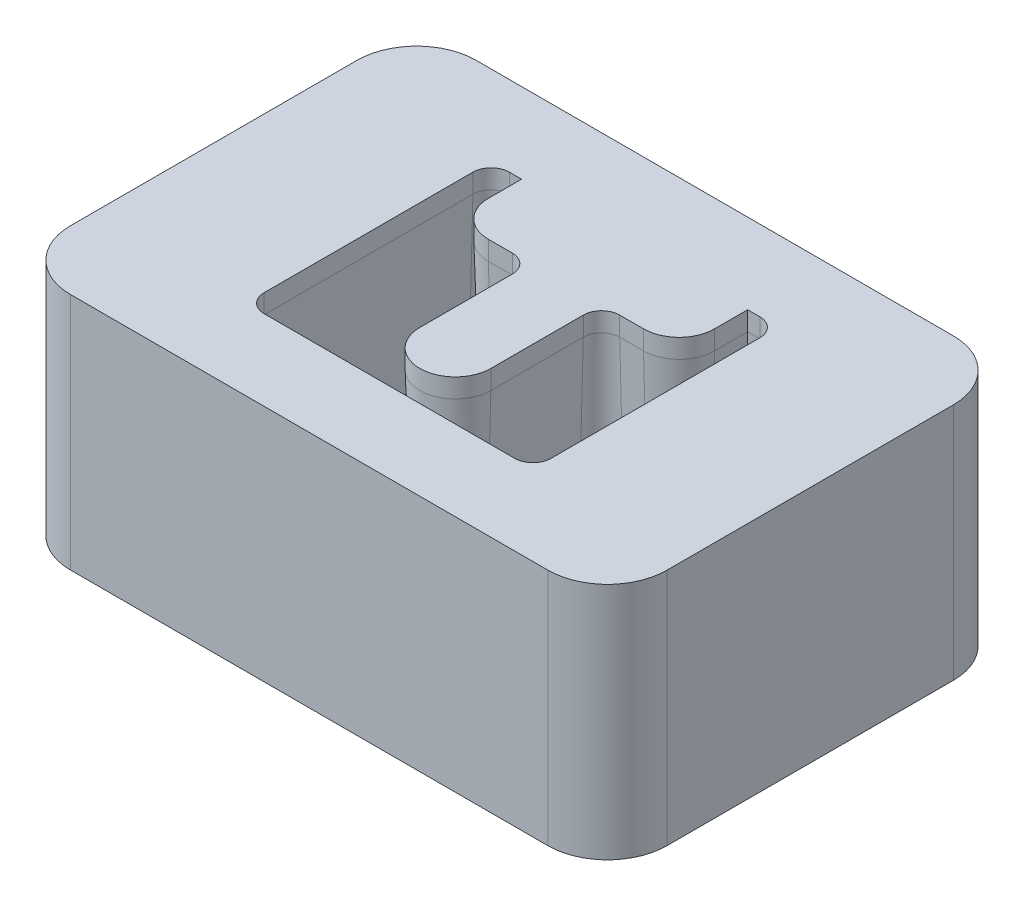
from build123d import *

# Parameters (mm, degrees)
SKETCH1_W                   = 100
SKETCH1_H                   = 68
BOSS_EXTRUDE1_DEPTH         = 40
FILLET1_R                   = 10
CUT_EXTRUDE1_REACH          = 74.498
M6_TAPPED_HOLE1_D           = 5
M6_TAPPED_HOLE1_DEPTH       = 17
M6_TAPPED_HOLE1_CSINK_D     = 6.05
M6_TAPPED_HOLE1_CSINK_ANGLE = 90
M6_TAPPED_HOLE1_TIP         = 1.502151548


with BuildPart() as part:
    # Sketch1 → Boss-Extrude1 (new body)
    with BuildSketch(Plane(origin=(0, 0, 0), x_dir=(1, 0, 0), z_dir=(0, 1, 0))):
        Rectangle(SKETCH1_W, SKETCH1_H)
    extrude(amount=-BOSS_EXTRUDE1_DEPTH)

    # Fillet1
    fillet1_edges = [part.edges().sort_by_distance(p)[0] for p in [
        (-50, -20, -34),
        (50, -20, -34),
        (50, -20, 34),
        (-50, -20, 34),
    ]]
    fillet(fillet1_edges, radius=FILLET1_R)

    # Sketch2 → Cut-Extrude1 (cut, up to next)
    with BuildSketch(Plane(origin=(0, 0, 0), x_dir=(1, 0, 0), z_dir=(0, 1, 0)), mode=Mode.PRIVATE) as cut_extrude1_sk1:
        with BuildLine():
            Line((-21, -20.55), (21, -20.55))
            ThreePointArc((21, -20.55), (23.156675683, -19.656675683), (24.05, -17.5))
            Line((24.05, -17.5), (24.05, 17.5))
            ThreePointArc((24.05, 17.5), (23.156675683, 19.656675683), (21, 20.55))
            Line((21, 20.55), (18.95, 20.55))
            Line((18.95, 20.55), (18.95, 15))
            ThreePointArc((18.95, 15), (17.207285348, 10.792714652), (13, 9.05))
            Line((13, 9.05), (9, 9.05))
            ThreePointArc((9, 9.05), (6.843324317, 8.156675683), (5.95, 6))
            Line((5.95, 6), (5.95, -9.5))
            ThreePointArc((5.95, -9.5), (0, -15.45), (-5.95, -9.5))
            Line((-5.95, -9.5), (-5.95, 6))
            ThreePointArc((-5.95, 6), (-6.843324317, 8.156675683), (-9, 9.05))
            Line((-9, 9.05), (-13, 9.05))
            ThreePointArc((-13, 9.05), (-17.207285348, 10.792714652), (-18.95, 15))
            Line((-18.95, 15), (-18.95, 20.55))
            Line((-18.95, 20.55), (-21, 20.55))
            ThreePointArc((-21, 20.55), (-23.156675683, 19.656675683), (-24.05, 17.5))
            Line((-24.05, 17.5), (-24.05, -17.5))
            ThreePointArc((-24.05, -17.5), (-23.156675683, -19.656675683), (-21, -20.55))
        make_face()
    cut_extrude1_tool1 = extrude(cut_extrude1_sk1.sketch, amount=-CUT_EXTRUDE1_REACH, mode=Mode.PRIVATE) & part.part
    add(cut_extrude1_tool1.solids().sort_by_distance((0, 0, 19.917322))[0], mode=Mode.SUBTRACT)

    # Cut-Sweep1: sweep along a path in Sketch5
    with BuildLine(Plane(origin=(0, 0, 0), x_dir=(1, 0, 0), z_dir=(0, 1, 0))) as cut_sweep1_path:
        Line((-21, -20.55), (21, -20.55))
        ThreePointArc((21, -20.55), (23.156675683, -19.656675683), (24.05, -17.5))
        Line((24.05, -17.5), (24.05, 17.5))
        ThreePointArc((24.05, 17.5), (23.156675683, 19.656675683), (21, 20.55))
        Line((21, 20.55), (18.95, 20.55))
        Line((18.95, 20.55), (18.95, 15))
        ThreePointArc((18.95, 15), (17.207285348, 10.792714652), (13, 9.05))
        Line((13, 9.05), (9, 9.05))
        ThreePointArc((9, 9.05), (6.843324317, 8.156675683), (5.95, 6))
        Line((5.95, 6), (5.95, -9.5))
        ThreePointArc((5.95, -9.5), (0, -15.45), (-5.95, -9.5))
        Line((-5.95, -9.5), (-5.95, 6))
        ThreePointArc((-5.95, 6), (-6.843324317, 8.156675683), (-9, 9.05))
        Line((-9, 9.05), (-13, 9.05))
        ThreePointArc((-13, 9.05), (-17.207285348, 10.792714652), (-18.95, 15))
        Line((-18.95, 15), (-18.95, 20.55))
        Line((-18.95, 20.55), (-21, 20.55))
        ThreePointArc((-21, 20.55), (-23.156675683, 19.656675683), (-24.05, 17.5))
        Line((-24.05, 17.5), (-24.05, -17.5))
        ThreePointArc((-24.05, -17.5), (-23.156675683, -19.656675683), (-21, -20.55))
    # Sketch3 → Cut-Sweep1 (sweep, cut)
    with BuildSketch(Plane.XY):
        Polygon((24.05, -3.2), (25.013641914, -40), (23.05, -40), (23.05, -3.2), align=None)
    sweep(path=cut_sweep1_path.line, transition=Transition.RIGHT, mode=Mode.SUBTRACT)

    # M6 Tapped Hole1
    with Locations(Plane(origin=(0, -40, 0), x_dir=(-1, 0, 0), z_dir=(0, -1, 0))):
        with Locations((-43, 27), (43, 27), (43, -27), (-43, -27)):
            CounterSinkHole(M6_TAPPED_HOLE1_D / 2, M6_TAPPED_HOLE1_CSINK_D / 2, depth=M6_TAPPED_HOLE1_DEPTH, counter_sink_angle=M6_TAPPED_HOLE1_CSINK_ANGLE)
            with Locations((0, 0, -(M6_TAPPED_HOLE1_DEPTH + M6_TAPPED_HOLE1_TIP / 2))):  # 118° drill point
                Cone(0, M6_TAPPED_HOLE1_D / 2, M6_TAPPED_HOLE1_TIP, mode=Mode.SUBTRACT)


solid = part.part
